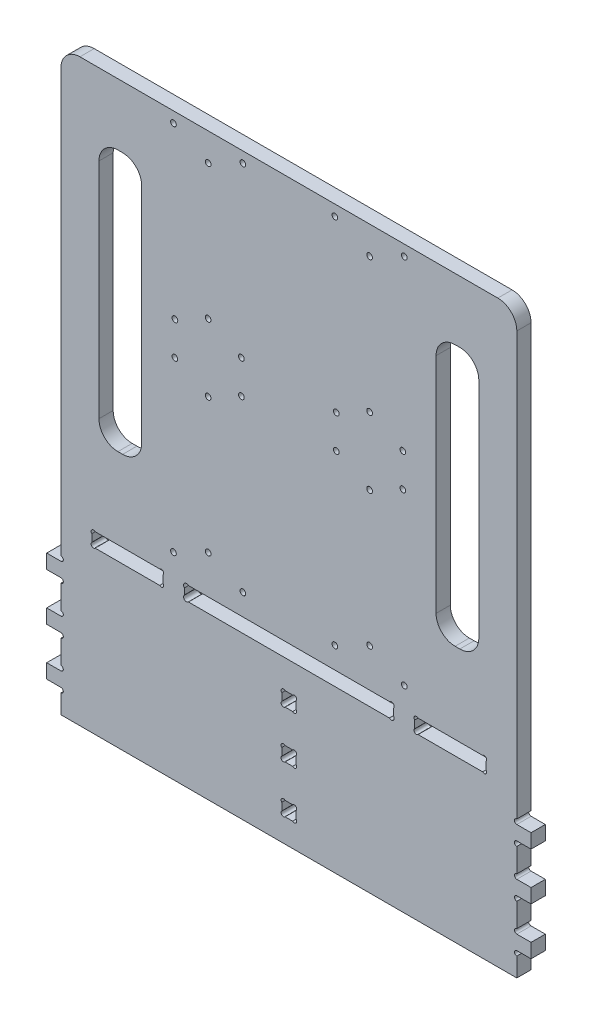
from build123d import *

# Parameters (mm, degrees)
BOSS_EXTRUDE1_DEPTH     = 19.05
CUT_EXTRUDE1_DEPTH      = 870.231272447
CUT_EXTRUDE1_DEPTH_BACK = 870.231272447
SKETCH2_W               = 609.6
SKETCH2_H               = 6.35
CUT_EXTRUDE2_DEPTH      = 870.231272447
SKETCH5_R               = 3.81
CUT_EXTRUDE3_DEPTH      = 19.05
SKETCH7_W               = 57.15
SKETCH7_H               = 349.25
CUT_EXTRUDE5_DEPTH      = 870.231272447
FILLET3_R               = 25.4
SKETCH8_W               = 57.15
SKETCH8_H               = 31.75
BOSS_EXTRUDE2_DEPTH     = 19.05
SKETCH11_W              = 57.15
SKETCH11_H              = 31.75
SKETCH11_W_2            = 101.589978172
SKETCH11_H_2            = 463.55
CUT_EXTRUDE7_DEPTH      = 211.328
CUT_EXTRUDE6_DEPTH      = 846.742766744
CUT_EXTRUDE6_DEPTH_BACK = 846.742766744
BOSS_EXTRUDE3_START     = -19.05
BOSS_EXTRUDE3_DEPTH     = 19.05
SKETCH12_W              = 57.15
SKETCH12_H              = 112.25036831
CUT_EXTRUDE8_DEPTH      = 228.346


with BuildPart() as part:
    # Sketch1 → Boss-Extrude1 (new body)
    with BuildSketch(Plane.XY):
        Polygon((-304.8, 38.1), (-304.8, 0), (304.8, 0), (304.8, 38.1), (323.85, 38.1), (323.85, 57.15), (304.8, 57.15), (304.8, 101.6), (323.85, 101.6), (323.85, 120.65), (304.8, 120.65), (304.8, 165.1), (323.85, 165.1), (323.85, 184.15), (304.8, 184.15), (304.8, 317.5), (381, 317.5), (381, 730.25), (304.8, 730.25), (304.8, 781.05), (-304.8, 781.05), (-304.8, 730.25), (-381, 730.25), (-381, 317.5), (-304.8, 317.5), (-304.8, 184.15), (-323.85, 184.15), (-323.85, 165.1), (-304.8, 165.1), (-304.8, 120.65), (-323.85, 120.65), (-323.85, 101.6), (-304.8, 101.6), (-304.8, 57.15), (-323.85, 57.15), (-323.85, 38.1), align=None)
        with BuildLine():
            Line((172.765128061, 241.3), (182.834871939, 241.3))
            ThreePointArc((182.834871939, 241.3), (187.325, 241.3), (187.325, 236.809871939))
            Line((187.325, 236.809871939), (187.325, 226.740128061))
            ThreePointArc((187.325, 226.740128061), (187.325, 222.25), (182.834871939, 222.25))
            Line((182.834871939, 222.25), (172.765128061, 222.25))
            ThreePointArc((172.765128061, 222.25), (168.275, 222.25), (168.275, 226.740128061))
            Line((168.275, 226.740128061), (168.275, 236.809871939))
            ThreePointArc((168.275, 236.809871939), (168.275, 241.3), (172.765128061, 241.3))
        make_face(mode=Mode.SUBTRACT)
        with BuildLine():
            Line((134.296762619, 222.25), (-134.296762619, 222.25))
            ThreePointArc((-134.296762619, 222.25), (-139.7, 222.25), (-139.7, 227.653237381))
            Line((-139.7, 227.653237381), (-139.7, 235.896762619))
            ThreePointArc((-139.7, 235.896762619), (-139.7, 241.3), (-134.296762619, 241.3))
            Line((-134.296762619, 241.3), (134.296762619, 241.3))
            ThreePointArc((134.296762619, 241.3), (139.7, 241.3), (139.7, 235.896762619))
            Line((139.7, 235.896762619), (139.7, 227.653237381))
            ThreePointArc((139.7, 227.653237381), (139.7, 222.25), (134.296762619, 222.25))
        make_face(mode=Mode.SUBTRACT)
        with BuildLine():
            Line((-172.765128061, 222.25), (-182.834871939, 222.25))
            ThreePointArc((-182.834871939, 222.25), (-187.325, 222.25), (-187.325, 226.740128061))
            Line((-187.325, 226.740128061), (-187.325, 236.809871939))
            ThreePointArc((-187.325, 236.809871939), (-187.325, 241.3), (-182.834871939, 241.3))
            Line((-182.834871939, 241.3), (-172.765128061, 241.3))
            ThreePointArc((-172.765128061, 241.3), (-168.275, 241.3), (-168.275, 236.809871939))
            Line((-168.275, 236.809871939), (-168.275, 226.740128061))
            ThreePointArc((-168.275, 226.740128061), (-168.275, 222.25), (-172.765128061, 222.25))
        make_face(mode=Mode.SUBTRACT)
        with BuildLine():
            Line((248.965128061, 241.3), (259.034871939, 241.3))
            ThreePointArc((259.034871939, 241.3), (263.525, 241.3), (263.525, 236.809871939))
            Line((263.525, 236.809871939), (263.525, 226.740128061))
            ThreePointArc((263.525, 226.740128061), (263.525, 222.25), (259.034871939, 222.25))
            Line((259.034871939, 222.25), (248.965128061, 222.25))
            ThreePointArc((248.965128061, 222.25), (244.475, 222.25), (244.475, 226.740128061))
            Line((244.475, 226.740128061), (244.475, 236.809871939))
            ThreePointArc((244.475, 236.809871939), (244.475, 241.3), (248.965128061, 241.3))
        make_face(mode=Mode.SUBTRACT)
        with BuildLine():
            Line((-248.965128061, 222.25), (-259.034871939, 222.25))
            ThreePointArc((-259.034871939, 222.25), (-263.525, 222.25), (-263.525, 226.740128061))
            Line((-263.525, 226.740128061), (-263.525, 236.809871939))
            ThreePointArc((-263.525, 236.809871939), (-263.525, 241.3), (-259.034871939, 241.3))
            Line((-259.034871939, 241.3), (-248.965128061, 241.3))
            ThreePointArc((-248.965128061, 241.3), (-244.475, 241.3), (-244.475, 236.809871939))
            Line((-244.475, 236.809871939), (-244.475, 226.740128061))
            ThreePointArc((-244.475, 226.740128061), (-244.475, 222.25), (-248.965128061, 222.25))
        make_face(mode=Mode.SUBTRACT)
        with BuildLine():
            ThreePointArc((-9.525, 52.659871939), (-9.525, 57.15), (-5.034871939, 57.15))
            Line((-5.034871939, 57.15), (5.034871939, 57.15))
            ThreePointArc((5.034871939, 57.15), (9.525, 57.15), (9.525, 52.659871939))
            Line((9.525, 52.659871939), (9.525, 42.590128061))
            ThreePointArc((9.525, 42.590128061), (9.525, 38.1), (5.034871939, 38.1))
            Line((5.034871939, 38.1), (-5.034871939, 38.1))
            ThreePointArc((-5.034871939, 38.1), (-9.525, 38.1), (-9.525, 42.590128061))
            Line((-9.525, 42.590128061), (-9.525, 52.659871939))
        make_face(mode=Mode.SUBTRACT)
        with BuildLine():
            ThreePointArc((-9.525, 179.659871939), (-9.525, 184.15), (-5.034871939, 184.15))
            Line((-5.034871939, 184.15), (5.034871939, 184.15))
            ThreePointArc((5.034871939, 184.15), (9.525, 184.15), (9.525, 179.659871939))
            Line((9.525, 179.659871939), (9.525, 169.590128061))
            ThreePointArc((9.525, 169.590128061), (9.525, 165.1), (5.034871939, 165.1))
            Line((5.034871939, 165.1), (-5.034871939, 165.1))
            ThreePointArc((-5.034871939, 165.1), (-9.525, 165.1), (-9.525, 169.590128061))
            Line((-9.525, 169.590128061), (-9.525, 179.659871939))
        make_face(mode=Mode.SUBTRACT)
        with BuildLine():
            ThreePointArc((-9.525, 116.159871939), (-9.525, 120.65), (-5.034871939, 120.65))
            Line((-5.034871939, 120.65), (5.034871939, 120.65))
            ThreePointArc((5.034871939, 120.65), (9.525, 120.65), (9.525, 116.159871939))
            Line((9.525, 116.159871939), (9.525, 106.090128061))
            ThreePointArc((9.525, 106.090128061), (9.525, 101.6), (5.034871939, 101.6))
            Line((5.034871939, 101.6), (-5.034871939, 101.6))
            ThreePointArc((-5.034871939, 101.6), (-9.525, 101.6), (-9.525, 106.090128061))
            Line((-9.525, 106.090128061), (-9.525, 116.159871939))
        make_face(mode=Mode.SUBTRACT)
    extrude(amount=-BOSS_EXTRUDE1_DEPTH)

    # Sketch2 → Cut-Extrude1 (cut, two sides: drawn at the far end of the back side and taken through both)
    with BuildSketch(Plane.XY.offset(-CUT_EXTRUDE1_DEPTH_BACK)):
        with Locations((0, 3.175)):
            Rectangle(SKETCH2_W, SKETCH2_H)
    extrude(amount=CUT_EXTRUDE1_DEPTH + CUT_EXTRUDE1_DEPTH_BACK, mode=Mode.SUBTRACT)

    # Sketch4 → Cut-Extrude2 (cut, through all)
    with BuildSketch(Plane.XY):
        with BuildLine():
            Line((-304.8, 190.5), (-304.8, 184.15))
            ThreePointArc((-304.8, 184.15), (-301.625, 187.325), (-304.8, 190.5))
        make_face()
        with BuildLine():
            Line((-304.8, 165.1), (-304.8, 158.75))
            ThreePointArc((-304.8, 158.75), (-301.625, 161.925), (-304.8, 165.1))
        make_face()
        with BuildLine():
            Line((-304.8, 127), (-304.8, 120.65))
            ThreePointArc((-304.8, 120.65), (-301.625, 123.825), (-304.8, 127))
        make_face()
        with BuildLine():
            Line((-304.8, 101.6), (-304.8, 95.25))
            ThreePointArc((-304.8, 95.25), (-301.625, 98.425), (-304.8, 101.6))
        make_face()
        with BuildLine():
            Line((-304.8, 38.1), (-304.8, 31.75))
            ThreePointArc((-304.8, 31.75), (-301.625, 34.925), (-304.8, 38.1))
        make_face()
        with BuildLine():
            Line((-304.8, 63.5), (-304.8, 57.15))
            ThreePointArc((-304.8, 57.15), (-301.625, 60.325), (-304.8, 63.5))
        make_face()
        with BuildLine():
            ThreePointArc((304.8, 38.1), (301.625, 34.925), (304.8, 31.75))
            Line((304.8, 31.75), (304.8, 38.1))
        make_face()
        with BuildLine():
            ThreePointArc((304.8, 63.5), (301.625, 60.325), (304.8, 57.15))
            Line((304.8, 57.15), (304.8, 63.5))
        make_face()
        with BuildLine():
            ThreePointArc((304.8, 101.6), (301.625, 98.425), (304.8, 95.25))
            Line((304.8, 95.25), (304.8, 101.6))
        make_face()
        with BuildLine():
            ThreePointArc((304.8, 127), (301.625, 123.825), (304.8, 120.65))
            Line((304.8, 120.65), (304.8, 127))
        make_face()
        with BuildLine():
            ThreePointArc((304.8, 165.1), (301.625, 161.925), (304.8, 158.75))
            Line((304.8, 158.75), (304.8, 165.1))
        make_face()
        with BuildLine():
            ThreePointArc((304.8, 190.5), (301.625, 187.325), (304.8, 184.15))
            Line((304.8, 184.15), (304.8, 190.5))
        make_face()
    extrude(amount=-CUT_EXTRUDE2_DEPTH, mode=Mode.SUBTRACT)

    # Sketch5 → Cut-Extrude3 (cut)
    with BuildSketch(Plane.XY):
        with Locations((-107.95, 743.808233844)):
            Circle(SKETCH5_R)
        with Locations((-107.95, 563.468233844)):
            Circle(SKETCH5_R)
        with Locations((-107.95, 473.149411281)):
            Circle(SKETCH5_R)
        with Locations((-107.95, 292.809411281)):
            Circle(SKETCH5_R)
        with Locations((-61.531915687, 269.949411281)):
            Circle(SKETCH5_R)
        with Locations((-63.5, 540.608233844)):
            Circle(SKETCH5_R)
        with Locations((-61.531915687, 766.668233844)):
            Circle(SKETCH5_R)
        with Locations((-63.5, 496.009411281)):
            Circle(SKETCH5_R)
        with Locations((-154.368084313, 269.949411281)):
            Circle(SKETCH5_R)
        with Locations((-152.4, 540.608233844)):
            Circle(SKETCH5_R)
        with Locations((-152.4, 496.009411281)):
            Circle(SKETCH5_R)
        with Locations((-154.368084313, 766.668233844)):
            Circle(SKETCH5_R)
        with Locations((154.368084313, 766.668233844)):
            Circle(SKETCH5_R)
        with Locations((152.4, 496.009411281)):
            Circle(SKETCH5_R)
        with Locations((152.4, 540.608233844)):
            Circle(SKETCH5_R)
        with Locations((154.368084313, 269.949411281)):
            Circle(SKETCH5_R)
        with Locations((63.5, 496.009411281)):
            Circle(SKETCH5_R)
        with Locations((61.531915687, 766.668233844)):
            Circle(SKETCH5_R)
        with Locations((63.5, 540.608233844)):
            Circle(SKETCH5_R)
        with Locations((61.531915687, 269.949411281)):
            Circle(SKETCH5_R)
        with Locations((107.95, 292.809411281)):
            Circle(SKETCH5_R)
        with Locations((107.95, 473.149411281)):
            Circle(SKETCH5_R)
        with Locations((107.95, 563.468233844)):
            Circle(SKETCH5_R)
        with Locations((107.95, 743.808233844)):
            Circle(SKETCH5_R)
    extrude(amount=-CUT_EXTRUDE3_DEPTH, mode=Mode.SUBTRACT)

    # Sketch7 → Cut-Extrude5 (cut, through all)
    with BuildSketch(Plane.XY):
        with Locations((-225.425, 523.875)):
            Rectangle(SKETCH7_W, SKETCH7_H)
    cut_extrude5 = extrude(amount=-CUT_EXTRUDE5_DEPTH, mode=Mode.SUBTRACT)

    # Mirror1: Cut-Extrude5 across plane
    add(cut_extrude5.mirror(Plane(origin=(0, 0, 0), x_dir=(0, 0, 1), z_dir=(1, 0, 0))), mode=Mode.SUBTRACT)

    # Fillet3
    fillet3_edges = [part.edges().sort_by_distance(p)[0] for p in [
        (-304.8, 781.05, -9.525),
        (304.8, 781.05, -9.525),
        (304.8, 317.5, -9.525),
        (304.8, 730.25, -9.525),
        (-304.8, 730.25, -9.525),
        (-304.8, 317.5, -9.525),
        (-381, 317.5, -9.525),
        (-381, 730.25, -9.525),
        (381, 730.25, -9.525),
        (381, 317.5, -9.525),
        (-254, 349.25, -9.525),
        (-254, 698.5, -9.525),
        (-196.85, 698.5, -9.525),
        (-196.85, 349.25, -9.525),
        (254, 698.5, -9.525),
        (254, 349.25, -9.525),
        (196.85, 349.25, -9.525),
        (196.85, 698.5, -9.525),
    ]]
    fillet(fillet3_edges, radius=FILLET3_R - 0.0001)  # a hair under: the kernel refuses the full size

    # Sketch8 → Boss-Extrude2 (add)
    with BuildSketch(Plane.XY):
        with Locations((-225.425, 523.875)):
            Rectangle(SKETCH8_W, SKETCH8_H)
    boss_extrude2 = extrude(amount=-BOSS_EXTRUDE2_DEPTH)

    # Sketch11 → Cut-Extrude7 (cut)
    with BuildSketch(Plane.XY):
        with Locations((-225.425, 523.875)):
            Rectangle(SKETCH11_W, SKETCH11_H)
        with Locations((-355.594989086, 523.875)):
            Rectangle(SKETCH11_W_2, SKETCH11_H_2)
        with Locations((355.594989086, 523.875)):
            Rectangle(SKETCH11_W_2, SKETCH11_H_2)
    extrude(amount=-CUT_EXTRUDE7_DEPTH, mode=Mode.SUBTRACT)

    # Mirror2: Boss-Extrude2 across plane
    add(boss_extrude2.mirror(Plane(origin=(0, 0, 0), x_dir=(0, 0, 1), z_dir=(1, 0, 0))))

    # Sketch9 → Cut-Extrude6 (cut, two sides: drawn at the far end of the back side and taken through both)
    with BuildSketch(Plane(origin=(0, 0, -19.05), x_dir=(-1, 0, 0), z_dir=(0, 0, -1)).offset(-CUT_EXTRUDE6_DEPTH_BACK)):
        with BuildLine():
            Line((-248.965128061, 222.25), (-259.034871939, 222.25))
            ThreePointArc((-259.034871939, 222.25), (-263.525, 222.25), (-263.525, 226.740128061))
            Line((-263.525, 226.740128061), (-263.525, 236.809871939))
            ThreePointArc((-263.525, 236.809871939), (-263.525, 241.3), (-259.034871939, 241.3))
            Line((-259.034871939, 241.3), (-248.965128061, 241.3))
            Line((-248.965128061, 241.3), (-172.765128061, 241.3))
            ThreePointArc((-172.765128061, 241.3), (-168.275, 241.3), (-168.275, 236.809871939))
            Line((-168.275, 236.809871939), (-168.275, 226.740128061))
            ThreePointArc((-168.275, 226.740128061), (-168.275, 222.25), (-172.765128061, 222.25))
            Line((-172.765128061, 222.25), (-248.965128061, 222.25))
        make_face()
        with BuildLine():
            Line((168.275, 236.809871939), (168.275, 226.740128061))
            ThreePointArc((168.275, 226.740128061), (168.275, 222.25), (172.765128061, 222.25))
            Line((172.765128061, 222.25), (248.965128061, 222.25))
            Line((248.965128061, 222.25), (259.034871939, 222.25))
            ThreePointArc((259.034871939, 222.25), (263.525, 222.25), (263.525, 226.740128061))
            Line((263.525, 226.740128061), (263.525, 236.809871939))
            ThreePointArc((263.525, 236.809871939), (263.525, 241.3), (259.034871939, 241.3))
            Line((259.034871939, 241.3), (248.965128061, 241.3))
            Line((248.965128061, 241.3), (172.765128061, 241.3))
            ThreePointArc((172.765128061, 241.3), (168.275, 241.3), (168.275, 236.809871939))
        make_face()
    extrude(amount=CUT_EXTRUDE6_DEPTH + CUT_EXTRUDE6_DEPTH_BACK, mode=Mode.SUBTRACT)

    # Sketch10 → Boss-Extrude3 (add)
    with BuildSketch(Plane(origin=(0, 0, -19.05), x_dir=(-1, 0, 0), z_dir=(0, 0, -1)).offset(BOSS_EXTRUDE3_START)):
        with BuildLine():
            Line((-248.965128061, 241.3), (-244.475, 241.3))
            ThreePointArc((-244.475, 241.3), (-246.72006403, 242.22993597), (-248.965128061, 241.3))
        make_face()
        with BuildLine():
            Line((-187.325, 241.3), (-182.834871939, 241.3))
            ThreePointArc((-182.834871939, 241.3), (-185.07993597, 242.22993597), (-187.325, 241.3))
        make_face()
        with BuildLine():
            Line((-182.834871939, 222.25), (-187.325, 222.25))
            ThreePointArc((-187.325, 222.25), (-185.07993597, 221.32006403), (-182.834871939, 222.25))
        make_face()
        with BuildLine():
            Line((-244.475, 222.25), (-248.965128061, 222.25))
            ThreePointArc((-248.965128061, 222.25), (-246.72006403, 221.32006403), (-244.475, 222.25))
        make_face()
        with BuildLine():
            Line((244.475, 222.25), (248.965128061, 222.25))
            ThreePointArc((248.965128061, 222.25), (246.72006403, 221.32006403), (244.475, 222.25))
        make_face()
        with BuildLine():
            Line((182.834871939, 222.25), (187.325, 222.25))
            ThreePointArc((187.325, 222.25), (185.07993597, 221.32006403), (182.834871939, 222.25))
        make_face()
        with BuildLine():
            Line((187.325, 241.3), (182.834871939, 241.3))
            ThreePointArc((182.834871939, 241.3), (185.07993597, 242.22993597), (187.325, 241.3))
        make_face()
        with BuildLine():
            Line((248.965128061, 241.3), (244.475, 241.3))
            ThreePointArc((244.475, 241.3), (246.72006403, 242.22993597), (248.965128061, 241.3))
        make_face()
    extrude(amount=BOSS_EXTRUDE3_DEPTH)

    # Sketch12 → Cut-Extrude8 (cut)
    with BuildSketch(Plane.XY):
        with Locations((225.425, 553.199151772)):
            Rectangle(SKETCH12_W, SKETCH12_H)
    extrude(amount=-CUT_EXTRUDE8_DEPTH, mode=Mode.SUBTRACT)


solid = part.part
